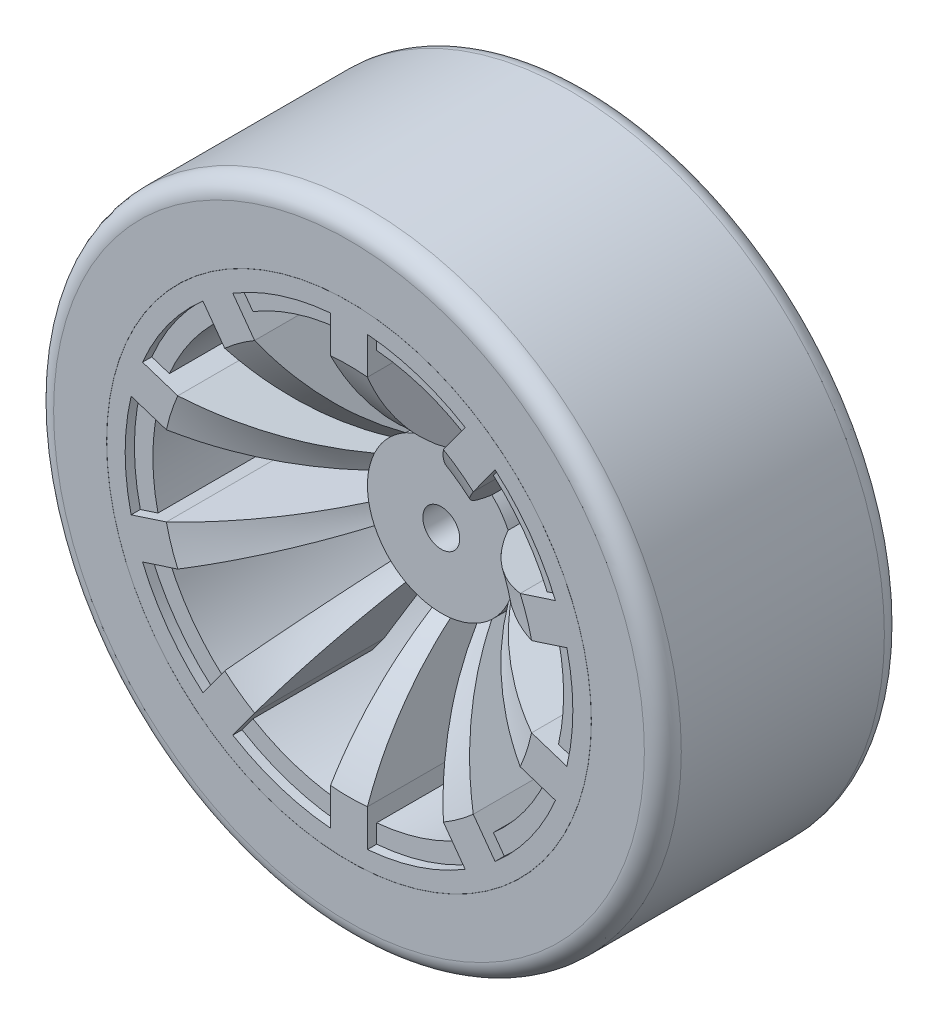
from build123d import *
from build123d.topology import SkipClean

# Parameters (mm, degrees)
CUT_EXTRUDE1_DEPTH  = 46.322455803
CUT_EXTRUDE2_DEPTH  = 1
CUT_EXTRUDE3_DEPTH  = 45.756284475
FILLET1_R           = 2
BOSS_EXTRUDE1_DEPTH = 1
SKETCH11_R          = 5.5
BOSS_EXTRUDE2_DEPTH = 11


with BuildPart() as part:
    # Sketch2 → Revolve1 (revolve)
    with BuildSketch(Plane(origin=(0, 0, 0), x_dir=(1, 0, 0), z_dir=(0, 1, 0))):
        with BuildLine():
            Line((-26.25, 13), (-24.25, 13))
            Line((-24.25, 13), (-22.25, 11))
            Line((-22.25, 11), (-22.25, 1))
            Line((-22.25, 1), (-8, 1))
            Line((-8, 1), (-8, 5))
            Line((-8, 5), (-2, 5))
            Line((-2, 5), (-2, -3))
            Line((-2, -3), (-8, -3))
            ThreePointArc((-8, -3), (-13.49262351, -8.7746612), (-20.25, -13))
            Line((-20.25, -13), (-26.25, -13))
            Line((-26.25, -13), (-26.25, 13))
        make_face()
    revolve(axis=Axis((0, 0, -13), (0, 0, 1)))

    # Sketch4 → Cut-Extrude1 (cut, through all)
    with SkipClean():  # the faces are left unmerged after this step: merging them gives an invalid solid
        with BuildSketch(Plane.XY.offset(13)):
            with BuildLine():
                Line((-2, 20.150992531), (-1, 7.937253933))
                ThreePointArc((-1, 7.937253933), (-2.472135955, 7.60845213), (-3.856383811, 7.009158573))
                Line((-3.856383811, 7.009158573), (-10.22642224, 17.478065916))
                ThreePointArc((-10.22642224, 17.478065916), (-6.257594136, 19.258894455), (-2, 20.150992531))
            make_face()
            with BuildLine():
                Line((2, 20.150992531), (1, 7.937253933))
                ThreePointArc((1, 7.937253933), (2.472135955, 7.60845213), (3.856383811, 7.009158573))
                Line((3.856383811, 7.009158573), (10.22642224, 17.478065916))
                ThreePointArc((10.22642224, 17.478065916), (6.257594136, 19.258894455), (2, 20.150992531))
            make_face()
            with BuildLine():
                Line((13.462490218, 15.126924907), (5.4744178, 5.833588068))
                ThreePointArc((5.4744178, 5.833588068), (6.472135955, 4.702282018), (7.23976008, 3.40380287))
                Line((7.23976008, 3.40380287), (18.546698768, 8.129112178))
                ThreePointArc((18.546698768, 8.129112178), (16.382594136, 11.902651359), (13.462490218, 15.126924907))
            make_face()
            with BuildLine():
                Line((19.782766746, 4.324886113), (7.857794069, 1.501689838))
                ThreePointArc((7.857794069, 1.501689838), (8, 0), (7.857794069, -1.501689838))
                Line((7.857794069, -1.501689838), (19.782766746, -4.324886113))
                ThreePointArc((19.782766746, -4.324886113), (20.25, 0), (19.782766746, 4.324886113))
            make_face()
            with BuildLine():
                Line((18.546698768, -8.129112178), (7.23976008, -3.40380287))
                ThreePointArc((7.23976008, -3.40380287), (6.472135955, -4.702282018), (5.4744178, -5.833588068))
                Line((5.4744178, -5.833588068), (13.462490218, -15.126924907))
                ThreePointArc((13.462490218, -15.126924907), (16.382594136, -11.902651359), (18.546698768, -8.129112178))
            make_face()
            with BuildLine():
                Line((10.22642224, -17.478065916), (3.856383811, -7.009158573))
                ThreePointArc((3.856383811, -7.009158573), (2.472135955, -7.60845213), (1, -7.937253933))
                Line((1, -7.937253933), (2, -20.150992531))
                ThreePointArc((2, -20.150992531), (6.257594136, -19.258894455), (10.22642224, -17.478065916))
            make_face()
            with BuildLine():
                Line((-2, -20.150992531), (-1, -7.937253933))
                ThreePointArc((-1, -7.937253933), (-2.472135955, -7.60845213), (-3.856383811, -7.009158573))
                Line((-3.856383811, -7.009158573), (-10.22642224, -17.478065916))
                ThreePointArc((-10.22642224, -17.478065916), (-6.257594136, -19.258894455), (-2, -20.150992531))
            make_face()
            with BuildLine():
                Line((-13.462490218, -15.126924907), (-5.4744178, -5.833588068))
                ThreePointArc((-5.4744178, -5.833588068), (-6.472135955, -4.702282018), (-7.23976008, -3.40380287))
                Line((-7.23976008, -3.40380287), (-18.546698768, -8.129112178))
                ThreePointArc((-18.546698768, -8.129112178), (-16.382594136, -11.902651359), (-13.462490218, -15.126924907))
            make_face()
            with BuildLine():
                Line((-19.782766746, -4.324886113), (-7.857794069, -1.501689838))
                ThreePointArc((-7.857794069, -1.501689838), (-8, 0), (-7.857794069, 1.501689838))
                Line((-7.857794069, 1.501689838), (-19.782766746, 4.324886113))
                ThreePointArc((-19.782766746, 4.324886113), (-20.25, 0), (-19.782766746, -4.324886113))
            make_face()
            with BuildLine():
                Line((-18.546698768, 8.129112178), (-7.23976008, 3.40380287))
                ThreePointArc((-7.23976008, 3.40380287), (-6.472135955, 4.702282018), (-5.4744178, 5.833588068))
                Line((-5.4744178, 5.833588068), (-13.462490218, 15.126924907))
                ThreePointArc((-13.462490218, 15.126924907), (-16.382594136, 11.902651359), (-18.546698768, 8.129112178))
            make_face()
        extrude(amount=-CUT_EXTRUDE1_DEPTH, mode=Mode.SUBTRACT)
    add(part.part.scale(1), mode=Mode.REPLACE)  # the faces are merged on a copy

    # Sketch6 → Cut-Extrude2 (cut)
    with BuildSketch(Plane.XY.offset(13)):
        with BuildLine():
            Line((2, 20.150992531), (2, 24.167385047))
            ThreePointArc((2, 24.167385047), (7.493662114, 23.06312052), (12.587198528, 20.727395717))
            Line((12.587198528, 20.727395717), (10.22642224, 17.478065916))
            ThreePointArc((10.22642224, 17.478065916), (6.257594136, 19.258894455), (2, 20.150992531))
        make_face()
        with BuildLine():
            Line((-2, 20.150992531), (-2, 24.167385047))
            ThreePointArc((-2, 24.167385047), (-7.493662114, 23.06312052), (-12.587198528, 20.727395717))
            Line((-12.587198528, 20.727395717), (-10.22642224, 17.478065916))
            ThreePointArc((-10.22642224, 17.478065916), (-6.257594136, 19.258894455), (-2, 20.150992531))
        make_face()
        with BuildLine():
            Line((13.462490218, 15.126924907), (15.823266506, 18.376254708))
            ThreePointArc((15.823266506, 18.376254708), (19.618662114, 14.253792368), (22.366515042, 9.370245722))
            Line((22.366515042, 9.370245722), (18.546698768, 8.129112178))
            ThreePointArc((18.546698768, 8.129112178), (16.382594136, 11.902651359), (13.462490218, 15.126924907))
        make_face()
        with BuildLine():
            Line((19.782766746, 4.324886113), (23.602583019, 5.566019656))
            ThreePointArc((23.602583019, 5.566019656), (24.25, 0), (23.602583019, -5.566019656))
            Line((23.602583019, -5.566019656), (19.782766746, -4.324886113))
            ThreePointArc((19.782766746, -4.324886113), (20.25, 0), (19.782766746, 4.324886113))
        make_face()
        with BuildLine():
            Line((18.546698768, -8.129112178), (22.366515042, -9.370245722))
            ThreePointArc((22.366515042, -9.370245722), (19.618662114, -14.253792368), (15.823266506, -18.376254708))
            Line((15.823266506, -18.376254708), (13.462490218, -15.126924907))
            ThreePointArc((13.462490218, -15.126924907), (16.382594136, -11.902651359), (18.546698768, -8.129112178))
        make_face()
        with BuildLine():
            Line((10.22642224, -17.478065916), (12.587198528, -20.727395717))
            ThreePointArc((12.587198528, -20.727395717), (7.493662114, -23.06312052), (2, -24.167385047))
            Line((2, -24.167385047), (2, -20.150992531))
            ThreePointArc((2, -20.150992531), (6.257594136, -19.258894455), (10.22642224, -17.478065916))
        make_face()
        with BuildLine():
            Line((-2, -20.150992531), (-2, -24.167385047))
            ThreePointArc((-2, -24.167385047), (-7.493662114, -23.06312052), (-12.587198528, -20.727395717))
            Line((-12.587198528, -20.727395717), (-10.22642224, -17.478065916))
            ThreePointArc((-10.22642224, -17.478065916), (-6.257594136, -19.258894455), (-2, -20.150992531))
        make_face()
        with BuildLine():
            Line((-13.462490218, -15.126924907), (-15.823266506, -18.376254708))
            ThreePointArc((-15.823266506, -18.376254708), (-19.618662114, -14.253792368), (-22.366515042, -9.370245722))
            Line((-22.366515042, -9.370245722), (-18.546698768, -8.129112178))
            ThreePointArc((-18.546698768, -8.129112178), (-16.382594136, -11.902651359), (-13.462490218, -15.126924907))
        make_face()
        with BuildLine():
            Line((-19.782766746, -4.324886113), (-23.602583019, -5.566019656))
            ThreePointArc((-23.602583019, -5.566019656), (-24.25, 0), (-23.602583019, 5.566019656))
            Line((-23.602583019, 5.566019656), (-19.782766746, 4.324886113))
            ThreePointArc((-19.782766746, 4.324886113), (-20.25, 0), (-19.782766746, -4.324886113))
        make_face()
        with BuildLine():
            Line((-18.546698768, 8.129112178), (-22.366515042, 9.370245722))
            ThreePointArc((-22.366515042, 9.370245722), (-19.618662114, 14.253792368), (-15.823266506, 18.376254708))
            Line((-15.823266506, 18.376254708), (-13.462490218, 15.126924907))
            ThreePointArc((-13.462490218, 15.126924907), (-16.382594136, 11.902651359), (-18.546698768, 8.129112178))
        make_face()
    extrude(amount=-CUT_EXTRUDE2_DEPTH, mode=Mode.SUBTRACT)

    # Sketch8 → Cut-Extrude3 (cut, through all)
    with BuildSketch(Plane.XY.offset(12)):
        with BuildLine():
            Line((-2, 20.150992531), (-2, 22.159930054))
            ThreePointArc((-2, 22.159930054), (-6.875628125, 21.161007488), (-11.407246089, 19.103330512))
            Line((-11.407246089, 19.103330512), (-10.22642224, 17.478065916))
            ThreePointArc((-10.22642224, 17.478065916), (-6.257594136, 19.258894455), (-2, 20.150992531))
        make_face()
        with BuildLine():
            Line((2, 20.150992531), (2, 22.159930054))
            ThreePointArc((2, 22.159930054), (6.875628125, 21.161007488), (11.407246089, 19.103330512))
            Line((11.407246089, 19.103330512), (10.22642224, 17.478065916))
            ThreePointArc((10.22642224, 17.478065916), (6.257594136, 19.258894455), (2, 20.150992531))
        make_face()
        with BuildLine():
            Line((13.462490218, 15.126924907), (14.643314066, 16.752189503))
            ThreePointArc((14.643314066, 16.752189503), (18.000628125, 13.078221864), (20.45731189, 8.749908013))
            Line((20.45731189, 8.749908013), (18.546698768, 8.129112178))
            ThreePointArc((18.546698768, 8.129112178), (16.382594136, 11.902651359), (13.462490218, 15.126924907))
        make_face()
        with BuildLine():
            Line((19.782766746, 4.324886113), (21.693379867, 4.945681948))
            ThreePointArc((21.693379867, 4.945681948), (22.25, 0), (21.693379867, -4.945681948))
            Line((21.693379867, -4.945681948), (19.782766746, -4.324886113))
            ThreePointArc((19.782766746, -4.324886113), (20.25, 0), (19.782766746, 4.324886113))
        make_face()
        with BuildLine():
            Line((18.546698768, -8.129112178), (20.45731189, -8.749908013))
            ThreePointArc((20.45731189, -8.749908013), (18.000628125, -13.078221864), (14.643314066, -16.752189503))
            Line((14.643314066, -16.752189503), (13.462490218, -15.126924907))
            ThreePointArc((13.462490218, -15.126924907), (16.382594136, -11.902651359), (18.546698768, -8.129112178))
        make_face()
        with BuildLine():
            Line((10.22642224, -17.478065916), (11.407246089, -19.103330512))
            ThreePointArc((11.407246089, -19.103330512), (6.875628125, -21.161007488), (2, -22.159930054))
            Line((2, -22.159930054), (2, -20.150992531))
            ThreePointArc((2, -20.150992531), (6.257594136, -19.258894455), (10.22642224, -17.478065916))
        make_face()
        with BuildLine():
            Line((-2, -20.150992531), (-2, -22.159930054))
            ThreePointArc((-2, -22.159930054), (-6.875628125, -21.161007488), (-11.407246089, -19.103330512))
            Line((-11.407246089, -19.103330512), (-10.22642224, -17.478065916))
            ThreePointArc((-10.22642224, -17.478065916), (-6.257594136, -19.258894455), (-2, -20.150992531))
        make_face()
        with BuildLine():
            Line((-13.462490218, -15.126924907), (-14.643314066, -16.752189503))
            ThreePointArc((-14.643314066, -16.752189503), (-18.000628125, -13.078221864), (-20.45731189, -8.749908013))
            Line((-20.45731189, -8.749908013), (-18.546698768, -8.129112178))
            ThreePointArc((-18.546698768, -8.129112178), (-16.382594136, -11.902651359), (-13.462490218, -15.126924907))
        make_face()
        with BuildLine():
            Line((-19.782766746, -4.324886113), (-21.693379867, -4.945681948))
            ThreePointArc((-21.693379867, -4.945681948), (-22.25, 0), (-21.693379867, 4.945681948))
            Line((-21.693379867, 4.945681948), (-19.782766746, 4.324886113))
            ThreePointArc((-19.782766746, 4.324886113), (-20.25, 0), (-19.782766746, -4.324886113))
        make_face()
        with BuildLine():
            Line((-18.546698768, 8.129112178), (-20.45731189, 8.749908013))
            ThreePointArc((-20.45731189, 8.749908013), (-18.000628125, 13.078221864), (-14.643314066, 16.752189503))
            Line((-14.643314066, 16.752189503), (-13.462490218, 15.126924907))
            ThreePointArc((-13.462490218, 15.126924907), (-16.382594136, 11.902651359), (-18.546698768, 8.129112178))
        make_face()
    extrude(amount=-CUT_EXTRUDE3_DEPTH, mode=Mode.SUBTRACT)

    # Sketch9 → Revolve2 (revolve)
    with BuildSketch(Plane(origin=(0, 0, 0), x_dir=(1, 0, 0), z_dir=(0, 1, 0))):
        Polygon((-26.26, 13), (-25.761627433, 12.501627433), (-25.761627433, -12.501627433), (-26.26, -13), (-34, -13), (-34, 13), align=None)
    revolve(axis=Axis((0, 0, -20.687459447), (0, 0, 1)))

    # Fillet1
    fillet1_edges = [part.edges().sort_by_distance(p)[0] for p in [
        (34, 0, 13),
        (34, 0, -13),
    ]]
    fillet(fillet1_edges, radius=FILLET1_R)

    # Sketch10 → Boss-Extrude1 (add)
    with BuildSketch(Plane(origin=(0, 0, -5), x_dir=(-1, 0, 0), z_dir=(0, 0, -1))):
        Polygon((-3.464101615, 6), (-6.92820323, 0), (-3.464101615, -6), (3.464101615, -6), (6.92820323, 0), (3.464101615, 6), align=None)
    extrude(amount=BOSS_EXTRUDE1_DEPTH)

    # Sketch11 → Boss-Extrude2 (add)
    with BuildSketch(Plane(origin=(0, 0, -6), x_dir=(-1, 0, 0), z_dir=(0, 0, -1))):
        Circle(SKETCH11_R)
    extrude(amount=BOSS_EXTRUDE2_DEPTH)


solid = part.part
